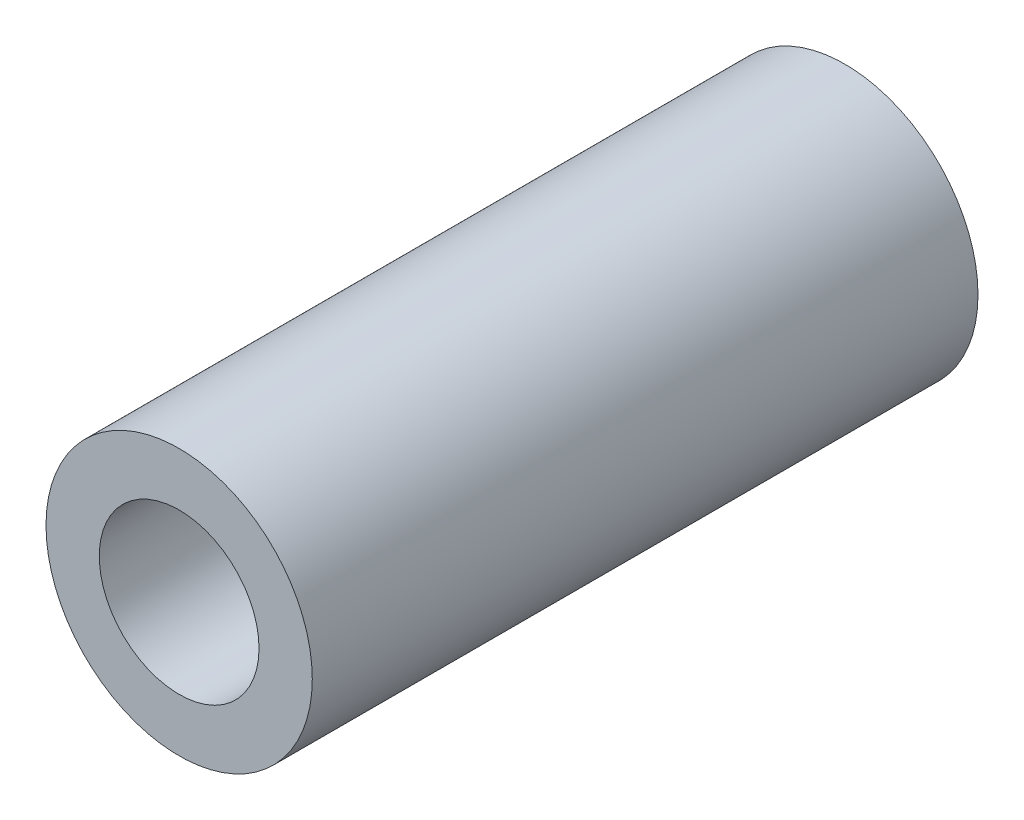
from build123d import *

# Parameters (mm, degrees)
SKETCH1_R           = 10
SKETCH1_R_2         = 6
BOSS_EXTRUDE1_DEPTH = 50


with BuildPart() as part:
    # Sketch1 → Boss-Extrude1 (new body)
    with BuildSketch(Plane.XY):
        Circle(SKETCH1_R)
        Circle(SKETCH1_R_2, mode=Mode.SUBTRACT)
    extrude(amount=BOSS_EXTRUDE1_DEPTH)


solid = part.part
